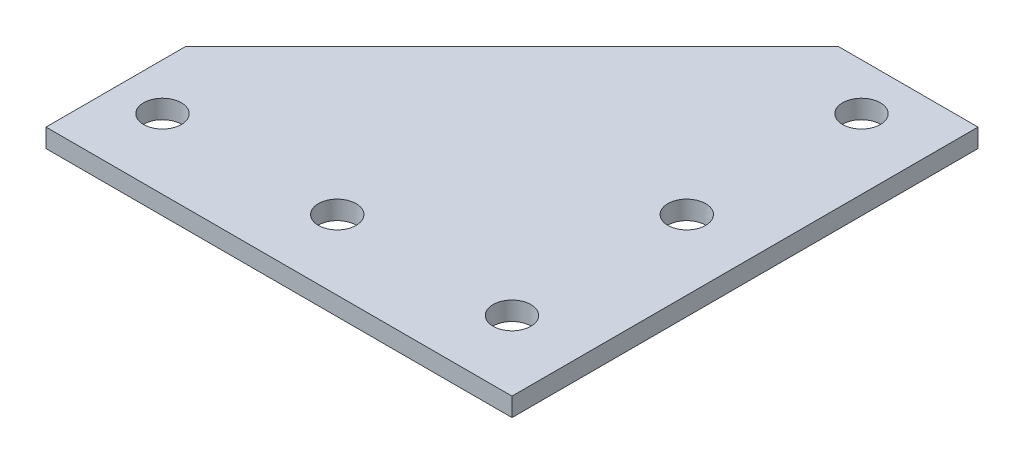
from build123d import *

# Parameters (mm, degrees)
SKETCH1_R           = 4.05
BOSS_EXTRUDE1_DEPTH = 4


with BuildPart() as part:
    # Sketch1 → Boss-Extrude1 (new body)
    with BuildSketch(Plane(origin=(0, 0, 0), x_dir=(1, 0, 0), z_dir=(0, 1, 0))):
        Polygon((15, -15), (-85, -15), (-85, 15), (-15, 85), (15, 85), align=None)
        with Locations((-75, 0)):
            Circle(SKETCH1_R, mode=Mode.SUBTRACT)
        with Locations((-37.5, 0)):
            Circle(SKETCH1_R, mode=Mode.SUBTRACT)
        Circle(SKETCH1_R, mode=Mode.SUBTRACT)
        with Locations((0, 75)):
            Circle(SKETCH1_R, mode=Mode.SUBTRACT)
        with Locations((0, 37.5)):
            Circle(SKETCH1_R, mode=Mode.SUBTRACT)
    extrude(amount=BOSS_EXTRUDE1_DEPTH)


solid = part.part
